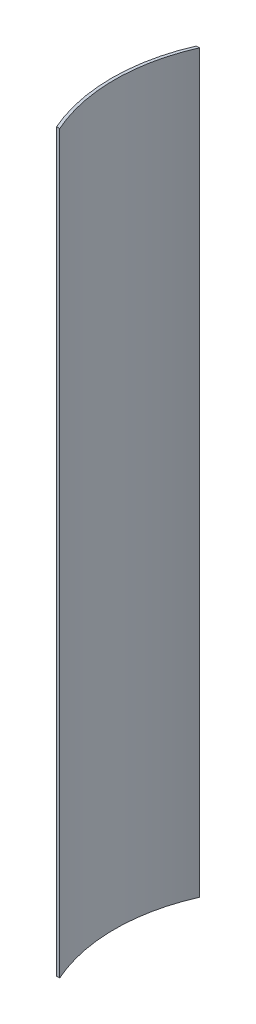
from build123d import *

# Parameters (mm, degrees)
SKETCH1_W           = 508
SKETCH1_H           = 241.3
BOSS_EXTRUDE1_DEPTH = 1270
CUT_EXTRUDE4_START  = -1270
CUT_EXTRUDE4_DEPTH  = 1270


# Read off the part's stored shape, not the designer's step: Cut-Extrude4
with BuildPart() as part:
    # Sketch1 → Boss-Extrude1 (new body)
    with BuildSketch(Plane(origin=(0, 0, 0), x_dir=(1, 0, 0), z_dir=(0, 1, 0))):
        with Locations((44.796719309, -28.633525346)):
            Rectangle(SKETCH1_W, SKETCH1_H)
    extrude(amount=BOSS_EXTRUDE1_DEPTH)

    # Cut-Extrude4 outline → Cut-Extrude4 (cut)
    with BuildSketch(Plane(origin=(0, 1270, 0), x_dir=(1, 0, 0), z_dir=(0, 1, 0)).offset(CUT_EXTRUDE4_START)):
        with BuildLine():
            Line((298.796719309, 92.016474654), (27.527020301, 92.016474654))
            ThreePointArc((27.527020301, 92.016474654), (1.906719309, -28.633525346), (27.527020301, -149.283525346))
            Line((27.527020301, -149.283525346), (298.796719309, -149.283525346))
            Line((298.796719309, -149.283525346), (298.796719309, 92.016474654))
        make_face()
        with BuildLine():
            ThreePointArc((22.063725974, -149.283525346), (-3.093280691, -28.633525346), (22.063725974, 92.016474654))
            Line((22.063725974, 92.016474654), (-209.203280691, 92.016474654))
            Line((-209.203280691, 92.016474654), (-209.203280691, -149.283525346))
            Line((-209.203280691, -149.283525346), (22.063725974, -149.283525346))
        make_face()
    extrude(amount=CUT_EXTRUDE4_DEPTH, mode=Mode.SUBTRACT)


solid = part.part
